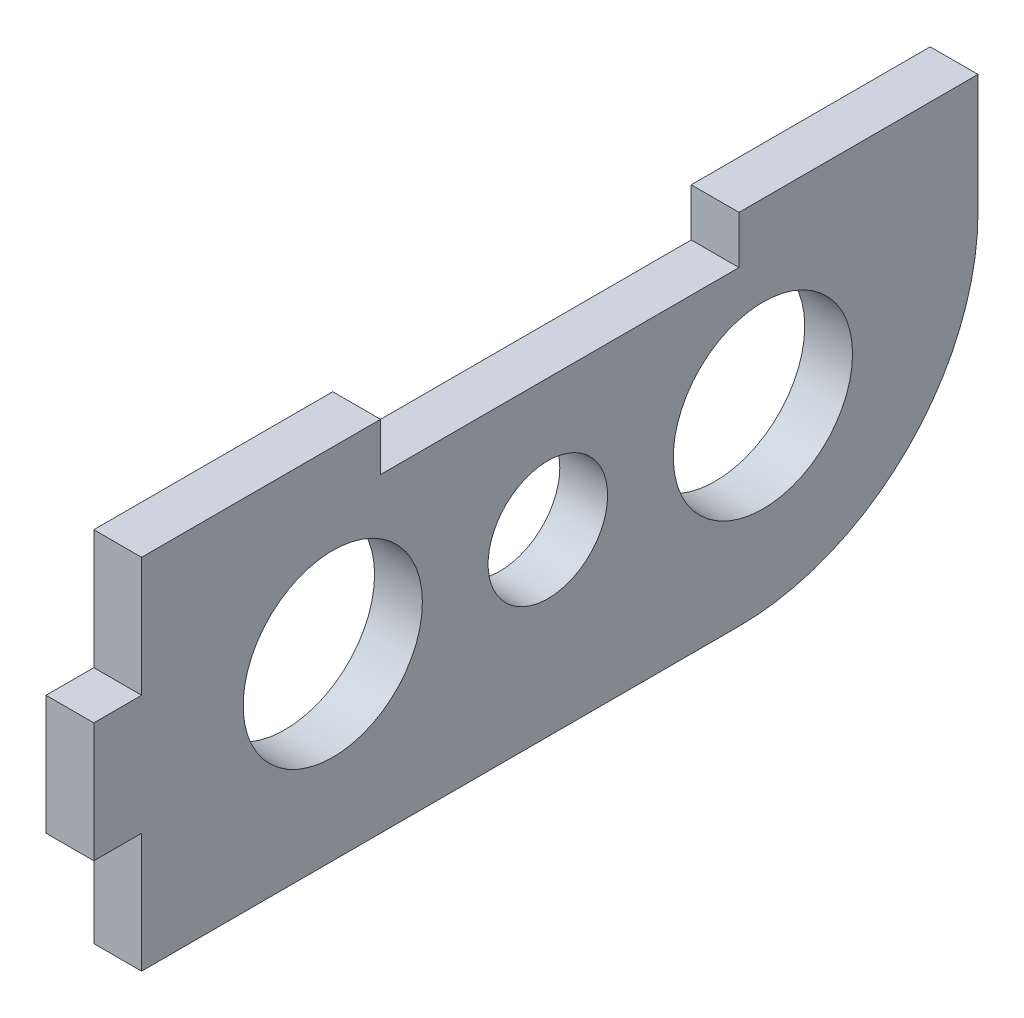
from build123d import *

# Parameters (mm, degrees)
AUFSATZ_LINEAR_AUSTRAGEN1_DEPTH = 4
SKIZZE3_W                       = 30
SKIZZE3_H                       = 4
SCHNITT_LINEAR_AUSTRAGEN2_DEPTH = 76.610845783
VERRUNDUNG1_R                   = 20
SKIZZE5_R                       = 7.5
SKIZZE5_R_2                     = 5
SCHNITT_LINEAR_AUSTRAGEN4_DEPTH = 76.610845783


with BuildPart() as part:
    # Skizze1 → Aufsatz-Linear austragen1 (new body)
    with BuildSketch(Plane(origin=(0, 0, 0), x_dir=(0, 0, -1), z_dir=(1, 0, 0))):
        Polygon((0, -5), (0, 5), (4, 5), (4, 15), (74, 15), (74, -15), (4, -15), (4, -5), align=None)
    extrude(amount=AUFSATZ_LINEAR_AUSTRAGEN1_DEPTH)

    # Skizze3 → Schnitt-Linear austragen2 (cut, through all)
    with BuildSketch(Plane(origin=(4, 0, 0), x_dir=(0, 0, -1), z_dir=(1, 0, 0))):
        with Locations((39, 13)):
            Rectangle(SKIZZE3_W, SKIZZE3_H)
    extrude(amount=-SCHNITT_LINEAR_AUSTRAGEN2_DEPTH, mode=Mode.SUBTRACT)

    # Verrundung1
    verrundung1_edges = [part.edges().sort_by_distance(p)[0] for p in [
        (2, -15, -74),
    ]]
    fillet(verrundung1_edges, radius=VERRUNDUNG1_R)

    # Skizze5 → Schnitt-Linear austragen4 (cut, through all)
    with BuildSketch(Plane(origin=(4, 0, 0), x_dir=(0, 0, -1), z_dir=(1, 0, 0))):
        with Locations((20, 0)):
            Circle(SKIZZE5_R)
        with Locations((56, 0)):
            Circle(SKIZZE5_R)
        with Locations((38, 0)):
            Circle(SKIZZE5_R_2)
    extrude(amount=-SCHNITT_LINEAR_AUSTRAGEN4_DEPTH, mode=Mode.SUBTRACT)


solid = part.part
